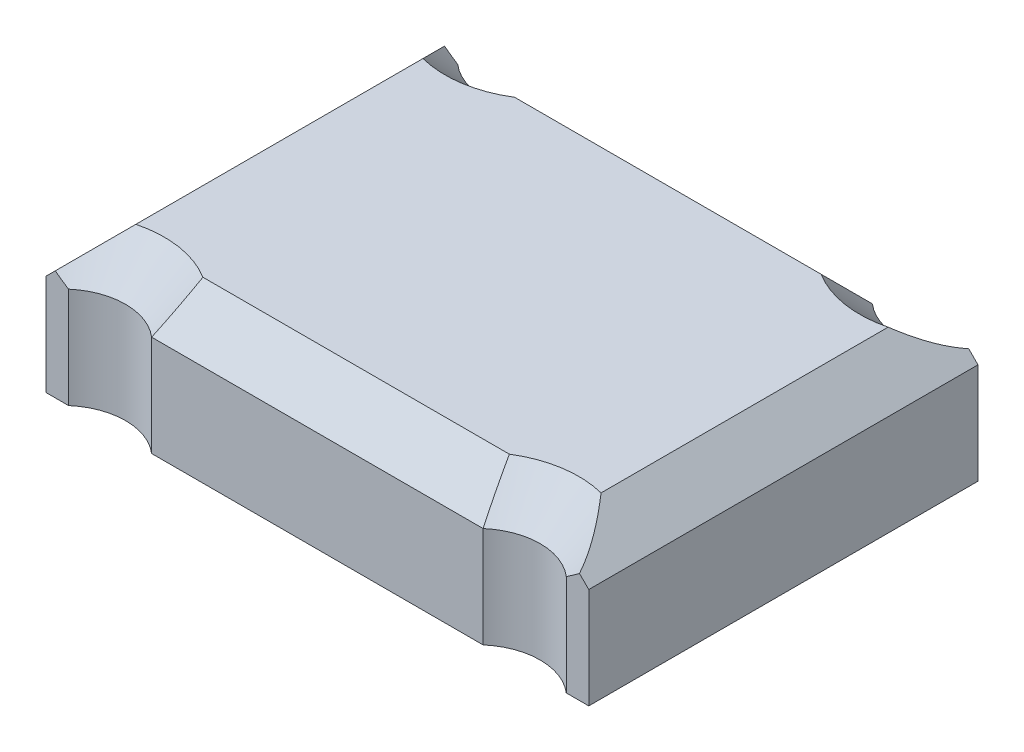
from build123d import *

# Parameters (mm, degrees)
EXTRUDE_1_DEPTH = 1.8
CHAMFER_1_SIZE  = 0.5


with BuildPart() as part:
    # Эскиз1 → Бобышка-Вытянуть1 (new body)
    with BuildSketch(Plane(origin=(0, 0, 0), x_dir=(1, 0, 0), z_dir=(0, 1, 0))):
        with BuildLine():
            Line((-3.5, 2.51), (-3.210140252, 2.51))
            ThreePointArc((-3.210140252, 2.51), (-2.673786949, 2.310468426), (-2.137433645, 2.51))
            Line((-2.137433645, 2.51), (2.137433645, 2.51))
            ThreePointArc((2.137433645, 2.51), (2.673786949, 2.310468426), (3.210140252, 2.51))
            Line((3.210140252, 2.51), (3.5, 2.51))
            Line((3.5, 2.51), (3.5, -2.51))
            Line((3.5, -2.51), (3.210140252, -2.51))
            ThreePointArc((3.210140252, -2.51), (2.673786949, -2.310468426), (2.137433645, -2.51))
            Line((2.137433645, -2.51), (-2.137433645, -2.51))
            ThreePointArc((-2.137433645, -2.51), (-2.673786949, -2.310468426), (-3.210140252, -2.51))
            Line((-3.210140252, -2.51), (-3.5, -2.51))
            Line((-3.5, -2.51), (-3.5, 2.51))
        make_face()
    extrude(amount=EXTRUDE_1_DEPTH)

    # Фаска1
    chamfer_1_edges = [part.edges().sort_by_distance(p)[0] for p in [
        (-3.5, 1.8, 0),
    ]]
    chamfer(chamfer_1_edges, length=CHAMFER_1_SIZE)
    chamfer_1_2_edges = [part.edges().sort_by_distance(p)[0] for p in [
        (3.5, 1.8, 0),
    ]]
    chamfer(chamfer_1_2_edges, length=CHAMFER_1_SIZE)
    chamfer_1_3_edges = [part.edges().sort_by_distance(p)[0] for p in [
        (-2.54973161, 1.8, 2.319899262),
    ]]
    chamfer(chamfer_1_3_edges, length=CHAMFER_1_SIZE)
    chamfer_1_4_edges = [part.edges().sort_by_distance(p)[0] for p in [
        (-2.54973161, 1.8, -2.319899262),
    ]]
    chamfer(chamfer_1_4_edges, length=CHAMFER_1_SIZE)
    chamfer_1_5_edges = [part.edges().sort_by_distance(p)[0] for p in [
        (2.54973161, 1.8, -2.319899262),
    ]]
    chamfer(chamfer_1_5_edges, length=CHAMFER_1_SIZE)
    chamfer_1_6_edges = [part.edges().sort_by_distance(p)[0] for p in [
        (2.54973161, 1.8, 2.319899262),
    ]]
    chamfer(chamfer_1_6_edges, length=CHAMFER_1_SIZE)
    chamfer_1_7_edges = [part.edges().sort_by_distance(p)[0] for p in [
        (0, 1.8, -2.51),
    ]]
    chamfer(chamfer_1_7_edges, length=CHAMFER_1_SIZE)
    chamfer_1_8_edges = [part.edges().sort_by_distance(p)[0] for p in [
        (0, 1.8, 2.51),
    ]]
    chamfer(chamfer_1_8_edges, length=CHAMFER_1_SIZE)


solid = part.part
